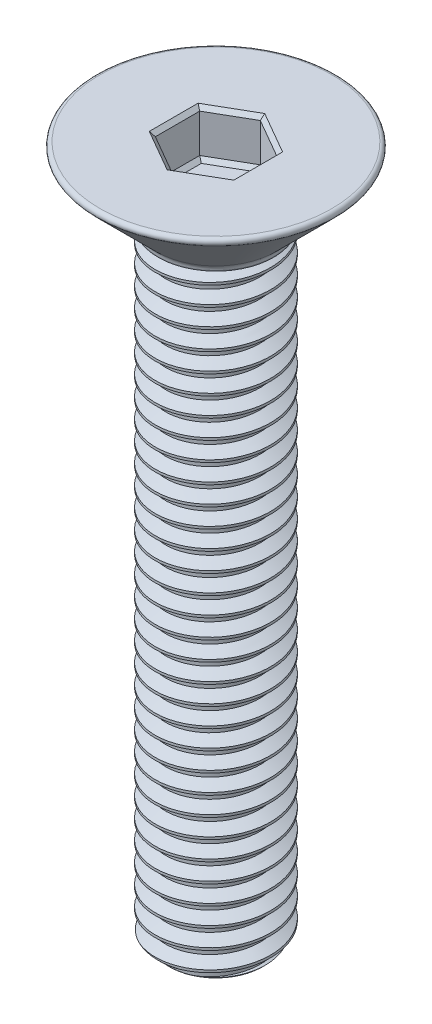
from build123d import *

# Parameters (mm, degrees)
SKETCH1_R           = 1.5
BOSS_EXTRUDE1_DEPTH = 16.14
THREAD1_PITCH       = 0.5
SKETCH5_R           = 1.5
BOSS_EXTRUDE2_DEPTH = 0.1
SKETCH6_R           = 1.5
BOSS_EXTRUDE3_DEPTH = 1.76
BOSS_EXTRUDE3_DRAFT = -45
FILLET1_R           = 0.1
FILLET2_R           = 0.2
CUT_EXTRUDE1_DEPTH  = 1.1
CHAMFER1_SIZE       = 0.1
CUT_EXTRUDE2_DEPTH  = 0.1
CUT_EXTRUDE2_DRAFT  = -45


with BuildPart() as part:
    # Sketch1 → Boss-Extrude1 (new body)
    with BuildSketch(Plane(origin=(0, 0, 0), x_dir=(1, 0, 0), z_dir=(0, 1, 0))):
        with Locations(Location((0, 0, 0), (0, 0, 270))):
            Circle(SKETCH1_R)
    extrude(amount=BOSS_EXTRUDE1_DEPTH)

    # Thread1: the profile of Thread Profile1 profile screwed along a right-hand helix of 34.28 turns, 6 arcs to a turn; built about Z, then put on its axis
    thread1_z = Axis((0, 0, 0), (0, 0, 1))
    thread1_corners = [(1.5003, 0, -0.000173205), (1.5003, 0, 0.437673204), (1.229367063, 0, 0.281249999), (1.229367063, 0, 0.156249999)]
    with BuildLine(mode=Mode.PRIVATE) as thread1_profile:
        Line(thread1_corners[0], thread1_corners[1])
        Line(thread1_corners[1], thread1_corners[2])
        Line(thread1_corners[2], thread1_corners[3])
        Line(thread1_corners[3], thread1_corners[0])
    thread1_cap = Face(thread1_profile.wire())
    thread1_turn_angles = [0, 30, 60, 90, 120, 150, 180, 210, 240, 270, 300, 330, 360]
    thread1_turn_weights = [1, 0.8660254037844387, 1, 0.8660254037844387, 1, 0.8660254037844387, 1, 0.8660254037844387, 1, 0.8660254037844387, 1, 0.8660254037844387, 1]
    thread1_turn_rails = [Edge.make_bspline([Vector(p[0], p[1], 0).rotate(thread1_z, thread1_turn_angles[k]) / thread1_turn_weights[k] + Vector(0, 0, p[2] + THREAD1_PITCH * thread1_turn_angles[k] / 360) for k in range(13)], [0, 0, 0, 1, 1, 2, 2, 3, 3, 4, 4, 5, 5, 6, 6, 6], 2, thread1_turn_weights) for p in thread1_corners]
    thread1_turn_sides = [Face.make_surface_from_curves(thread1_turn_rails[p[0]], thread1_turn_rails[p[1]]) for p in [(0, 1), (1, 2), (2, 3), (3, 0)]]
    thread1_last_angles = [12240, 12270, 12300, 12320.4, 12340.8]
    thread1_last_weights = [1, 0.8660254037844387, 1, 0.9372819894918827, 1]
    thread1_last_rails = [Edge.make_bspline([Vector(p[0], p[1], 0).rotate(thread1_z, thread1_last_angles[k]) / thread1_last_weights[k] + Vector(0, 0, p[2] + THREAD1_PITCH * thread1_last_angles[k] / 360) for k in range(5)], [0, 0, 0, 1, 1, 2, 2, 2], 2, thread1_last_weights) for p in thread1_corners]
    thread1_last_sides = [Face.make_surface_from_curves(thread1_last_rails[p[0]], thread1_last_rails[p[1]]) for p in [(0, 1), (1, 2), (2, 3), (3, 0)]]
    thread1 = Plane(origin=(0, 17.14, 0), x_dir=(-1, 0, 0), z_dir=(0, -1, 0)) * Solid(Shell([*[p.moved(Location((0, 0, THREAD1_PITCH * i))) for i in range(34) for p in thread1_turn_sides], *thread1_last_sides, thread1_cap, thread1_cap.rotate(thread1_z, 12340.8).moved(Location((0, 0, THREAD1_PITCH * 12340.8 / 360)))]))
    add(thread1, mode=Mode.SUBTRACT)

    # Sketch5 → Boss-Extrude2 (add)
    with BuildSketch(Plane(origin=(0, 16.14, 0), x_dir=(1, 0, 0), z_dir=(0, 1, 0))):
        with Locations(Location((0, 0, 0), (0, 0, 79.630240195))):
            Circle(SKETCH5_R)
    extrude(amount=BOSS_EXTRUDE2_DEPTH)


with BuildPart() as boss_extrude3_tool:
    # Sketch6 → Boss-Extrude3 (with draft: the straight prism first)
    with BuildSketch(Plane(origin=(0, 16.24, 0), x_dir=(1, 0, 0), z_dir=(0, 1, 0))):
        with Locations(Location((0, 0, 0), (0, 0, 79.630240195))):
            Circle(SKETCH6_R)
    extrude(amount=BOSS_EXTRUDE3_DEPTH)
    # Boss-Extrude3: the draft: its side faces are tilted about the plane it starts from
    boss_extrude3_sides = [boss_extrude3_tool.faces().sort_by_distance(p)[0] for p in [
        (-0.27, 17.12, 1.475499915),
    ]]
    draft(boss_extrude3_sides, Plane(origin=(0, 16.24, 0), x_dir=(1, 0, 0), z_dir=(0, 1, 0)), BOSS_EXTRUDE3_DRAFT)


with BuildPart() as part_1:
    add(part.part)

    # Boss-Extrude3: add boss_extrude3_tool
    add(boss_extrude3_tool.part)

    # Sketch7 → Cut-Revolve1 (revolve, cut)
    with BuildSketch(Plane.XY, mode=Mode.PRIVATE) as cut_revolve1_sk:
        Polygon((1.51, 0), (1.51, 0.3), (1.21, 0), align=None)
    revolve(cut_revolve1_sk.sketch.rotate(Axis((0, 0, 0), (0, 1, 0)), 135.522486844), axis=Axis((0, 0, 0), (0, 1, 0)), mode=Mode.SUBTRACT)

    # Fillet1
    fillet1_edges = [part_1.edges().sort_by_distance(p)[0] for p in [
        (-0.5868, 18, 3.206753149),
    ]]
    fillet(fillet1_edges, radius=FILLET1_R)

    # Fillet2
    fillet2_edges = [part_1.edges().sort_by_distance(p)[0] for p in [
        (-0.27, 16.24, 1.475499915),
    ]]
    fillet(fillet2_edges, radius=FILLET2_R)

    # Sketch8 → Cut-Extrude1 (cut)
    with BuildSketch(Plane(origin=(0, 18, 0), x_dir=(1, 0, 0), z_dir=(0, 1, 0))):
        Polygon((0, 1.154700538), (-1, 0.577350269), (-1, -0.577350269), (0, -1.154700538), (1, -0.577350269), (1, 0.577350269), align=None)
    extrude(amount=-CUT_EXTRUDE1_DEPTH, mode=Mode.SUBTRACT)

    # Chamfer1
    chamfer1_edges = [part_1.edges().sort_by_distance(p)[0] for p in [
        (0.5, 18, -0.866025404),
        (-0.5, 18, -0.866025404),
        (-1, 18, 0),
        (-0.5, 18, 0.866025404),
        (0.5, 18, 0.866025404),
        (1, 18, 0),
    ]]
    chamfer(chamfer1_edges, length=CHAMFER1_SIZE)


with BuildPart() as cut_extrude2_tool:
    # Sketch9 → Cut-Extrude2 (with draft: the straight prism first)
    with BuildSketch(Plane(origin=(0, 16.9, 0), x_dir=(1, 0, 0), z_dir=(0, 1, 0))):
        Polygon((0, 1.154700538), (-1, 0.577350269), (-1, -0.577350269), (0, -1.154700538), (1, -0.577350269), (1, 0.577350269), align=None)
    extrude(amount=-CUT_EXTRUDE2_DEPTH)
    # Cut-Extrude2: the draft: its side faces are tilted about the plane it starts from
    cut_extrude2_sides = [cut_extrude2_tool.faces().sort_by_distance(p)[0] for p in [
        (-0.5, 16.85, -0.866025404),
        (-1, 16.85, 0),
        (-0.5, 16.85, 0.866025404),
        (0.5, 16.85, 0.866025404),
        (1, 16.85, 0),
        (0.5, 16.85, -0.866025404),
    ]]
    draft(cut_extrude2_sides, Plane(origin=(0, 16.9, 0), x_dir=(1, 0, 0), z_dir=(0, 1, 0)), CUT_EXTRUDE2_DRAFT)


with BuildPart() as part_2:
    add(part_1.part)

    # Cut-Extrude2: cut by cut_extrude2_tool
    add(cut_extrude2_tool.part, mode=Mode.SUBTRACT)


solid = part_2.part
